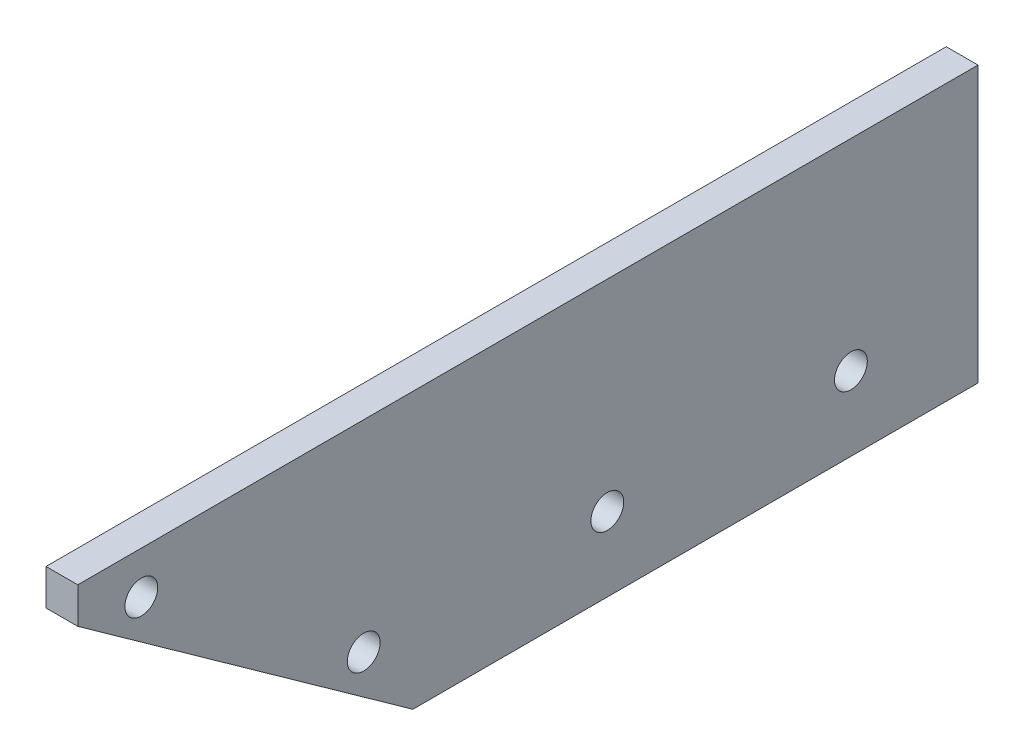
from build123d import *

# Parameters (mm, degrees)
SKIZZE1_W                       = 85
SKIZZE1_H                       = 26
AUFSATZ_LINEAR_AUSTRAGEN1_DEPTH = 3
SKIZZE2_R                       = 1.55
SCHNITT_LINEAR_AUSTRAGEN1_DEPTH = 89.938180777
SCHNITT_LINEAR_AUSTRAGEN2_DEPTH = 89.938180777


with BuildPart() as part:
    # Skizze1 → Aufsatz-Linear austragen1 (new body)
    with BuildSketch(Plane(origin=(0, 0, 0), x_dir=(0, 0, -1), z_dir=(1, 0, 0))):
        with Locations((42.5, 13)):
            Rectangle(SKIZZE1_W, SKIZZE1_H)
    extrude(amount=AUFSATZ_LINEAR_AUSTRAGEN1_DEPTH)

    # Skizze2 → Schnitt-Linear austragen1 (cut, through all)
    with BuildSketch(Plane(origin=(3, 0, 0), x_dir=(0, 0, -1), z_dir=(1, 0, 0))):
        with Locations((6, 22)):
            Circle(SKIZZE2_R)
        with Locations((27, 7)):
            Circle(SKIZZE2_R)
        with Locations((50, 7)):
            Circle(SKIZZE2_R)
        with Locations((73, 7)):
            Circle(SKIZZE2_R)
    extrude(amount=-SCHNITT_LINEAR_AUSTRAGEN1_DEPTH, mode=Mode.SUBTRACT)

    # Skizze3 → Schnitt-Linear austragen2 (cut, through all)
    with BuildSketch(Plane(origin=(3, 0, 0), x_dir=(0, 0, -1), z_dir=(1, 0, 0))):
        Polygon((0, 22.599003457), (31.63860484, 0), (0, 0), align=None)
    extrude(amount=-SCHNITT_LINEAR_AUSTRAGEN2_DEPTH, mode=Mode.SUBTRACT)


solid = part.part
